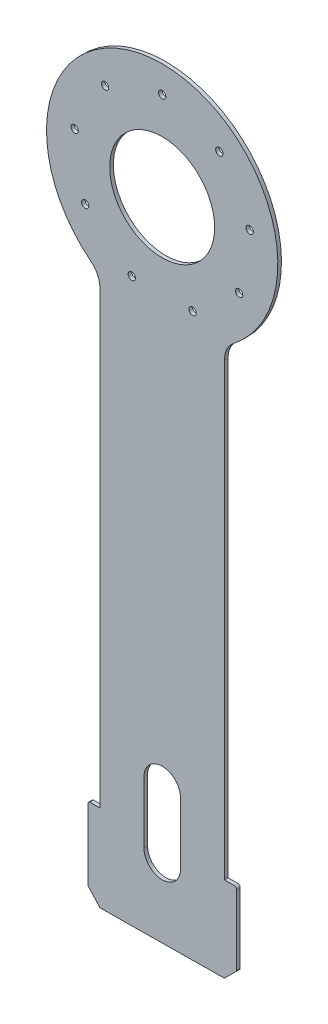
from build123d import *

# Parameters (mm, degrees)
SKETCH1_R             = 47.5
SKETCH1_R_2           = 21.55
BOSS_EXTRUDE1_DEPTH   = 1.5
F_3_0MM_DOWEL_HOLE1_D = 3
CIRPATTERN1_COUNT     = 9
BOSS_EXTRUDE2_DEPTH   = 1.5
FILLET7_R             = 10
FILLET8_R             = 10
FILLET9_R             = 1
FILLET10_R            = 1
CUT_EXTRUDE1_DEPTH    = 1.5


with BuildPart() as part:
    # Sketch1 → Boss-Extrude1 (new body)
    with BuildSketch(Plane.XY):
        Circle(SKETCH1_R)
        Circle(SKETCH1_R_2, mode=Mode.SUBTRACT)
    extrude(amount=BOSS_EXTRUDE1_DEPTH)

    # Ø3.0mm Dowel Hole1 (through all)
    with Locations(Plane.XY.offset(1.5)):
        with Locations((0, 36.5)):
            f_3_0mm_dowel_hole1 = Hole(F_3_0MM_DOWEL_HOLE1_D / 2)

    # CirPattern1: Ø3.0mm Dowel Hole1 ×9 about axis
    cirpattern1_axis = Axis((0, 0, 1.5), (0, 0, 1))
    for i in range(1, CIRPATTERN1_COUNT):
        add(f_3_0mm_dowel_hole1.rotate(cirpattern1_axis, i * 360 / CIRPATTERN1_COUNT), mode=Mode.SUBTRACT)

    # Sketch6 → Boss-Extrude2 (add)
    with BuildSketch(Plane.XY.offset(1.5)):
        Polygon((-25.563438214, -40.034492962), (25.563438214, -40.034492962), (25.563438214, -230.034492962), (30.563438214, -230.034492962), (30.563438214, -260.034492962), (25.563438214, -265.034492962), (-25.563438214, -265.5367607), (-30.563438214, -260.034492962), (-30.563438214, -230.034492962), (-25.563438214, -230.034492962), align=None)
    extrude(amount=-BOSS_EXTRUDE2_DEPTH)

    # Fillet7
    fillet7_edges = [part.edges().sort_by_distance(p)[0] for p in [
        (-25.563438214, -40.034492962, 0.75),
    ]]
    fillet(fillet7_edges, radius=FILLET7_R)

    # Fillet8
    fillet8_edges = [part.edges().sort_by_distance(p)[0] for p in [
        (25.563438214, -40.034492962, 0.75),
    ]]
    fillet(fillet8_edges, radius=FILLET8_R)

    # Fillet9
    fillet9_edges = [part.edges().sort_by_distance(p)[0] for p in [
        (-30.563438214, -230.034492962, 0.75),
        (30.563438214, -230.034492962, 0.75),
    ]]
    fillet(fillet9_edges, radius=FILLET9_R)

    # Fillet10
    fillet10_edges = [part.edges().sort_by_distance(p)[0] for p in [
        (-30.563438214, -260.034492962, 0.75),
        (-25.563438214, -265.5367607, 0.75),
        (25.563438214, -265.034492962, 0.75),
        (30.563438214, -260.034492962, 0.75),
    ]]
    fillet(fillet10_edges, radius=FILLET10_R)

    # Sketch7 → Cut-Extrude1 (cut)
    with BuildSketch(Plane(origin=(0, 0, 0), x_dir=(-1, 0, 0), z_dir=(0, 0, -1))):
        with BuildLine():
            Line((-7.519953185, -235.285430812), (-7.519953185, -209.885430812))
            ThreePointArc((-7.519953185, -209.885430812), (-0.019953185, -202.385430812), (7.480046815, -209.885430812))
            Line((7.480046815, -209.885430812), (7.480046815, -235.285430812))
            ThreePointArc((7.480046815, -235.285430812), (-0.019953185, -242.785430812), (-7.519953185, -235.285430812))
        make_face()
    extrude(amount=-CUT_EXTRUDE1_DEPTH, mode=Mode.SUBTRACT)


solid = part.part
